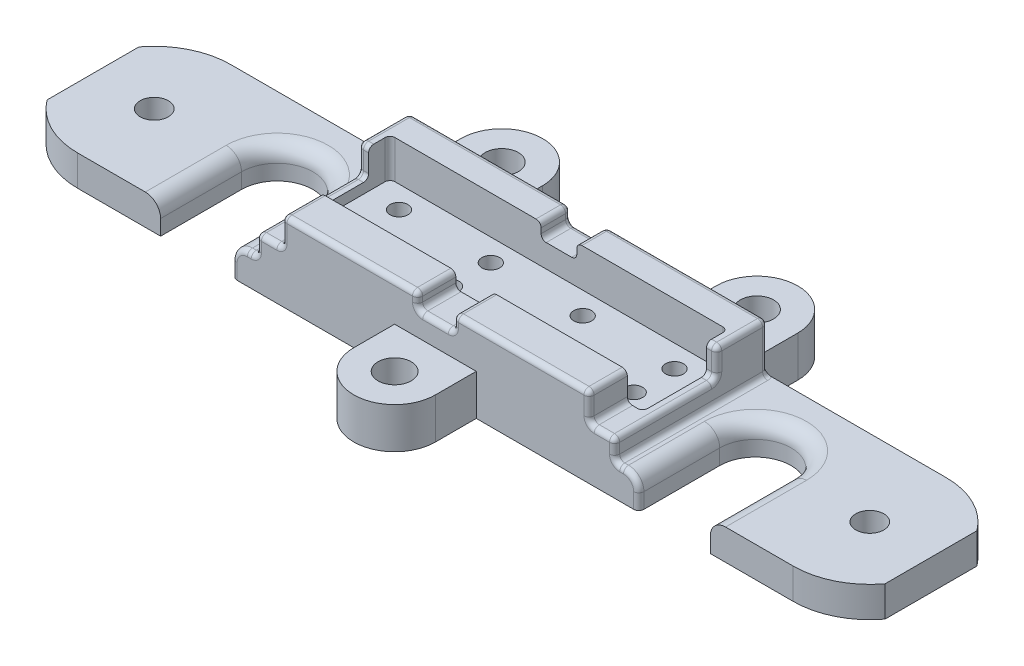
from build123d import *

# Parameters (mm, degrees)
SKETCH1_W               = 35.1
SKETCH1_H               = 30
BOSS_EXTRUDE1_DEPTH     = 15.5
SKETCH7_W               = 33.1
SKETCH7_H               = 16.7
CUT_EXTRUDE5_DEPTH      = 7.5
SKETCH2_R               = 1.75
CUT_EXTRUDE1_DEPTH      = 42.197815476
SKETCH4_W               = 20
SKETCH4_H               = 5.5
CUT_EXTRUDE3_DEPTH      = 5
SKETCH8_R               = 2.75
BOLT_EXTRUDE_DEPTH      = 6
FILLET3_R               = 1
SKETCH9_W               = 7
SKETCH9_H               = 30
CUT_EXTRUDE6_DEPTH      = 3
FILLET6_R               = 1
FILLET9_R               = 1
SKETCH11_W              = 140.2
SKETCH11_H              = 3
BOSS_EXTRUDE3_DEPTH     = 15
SKETCH12_R              = 3.25
BOSS_EXTRUDE4_DEPTH     = 8
CUT_EXTRUDE7_DEPTH      = 90.115991831
CUT_EXTRUDE7_DEPTH_BACK = 90.115991831
FILLET10_R              = 3
FILLET14_R              = 1
SKETCH13_W              = 62
SKETCH13_H              = 16
CUT_EXTRUDE8_DEPTH      = 4
FILLET15_R              = 2
FILLET16_R              = 0.5
SKETCH14_W              = 30
SKETCH14_H              = 15
CUT_EXTRUDE9_DEPTH      = 168.818026445


with BuildPart() as part:
    # Sketch1 → Boss-Extrude1 (new body)
    with BuildSketch(Plane(origin=(0, 0, 0), x_dir=(1, 0, 0), z_dir=(0, 1, 0))):
        with Locations((-17.55, 0)):
            Rectangle(SKETCH1_W, SKETCH1_H)
    extrude(amount=BOSS_EXTRUDE1_DEPTH)

    # Sketch7 → Cut-Extrude5 (cut)
    with BuildSketch(Plane(origin=(0, 15.5, 0), x_dir=(1, 0, 0), z_dir=(0, 1, 0))):
        with Locations((-16.55, 0.85)):
            Rectangle(SKETCH7_W, SKETCH7_H)
    extrude(amount=-CUT_EXTRUDE5_DEPTH, mode=Mode.SUBTRACT)

    # Sketch2 → Cut-Extrude1 (cut, through all)
    with BuildSketch(Plane(origin=(0, 0, 0), x_dir=(-1, 0, 0), z_dir=(0, 1, 0))):
        with Locations(Location((27, 3.15, 0), (0, 0, 270))):
            Circle(SKETCH2_R)
        with Locations(Location((9, 3.15, 0), (0, 0, 270))):
            Circle(SKETCH2_R)
        with Locations(Location((27, -4.85, 0), (0, 0, 270))):
            Circle(SKETCH2_R)
        with Locations(Location((9, -4.85, 0), (0, 0, 270))):
            Circle(SKETCH2_R)
    extrude(amount=CUT_EXTRUDE1_DEPTH, mode=Mode.SUBTRACT)

    # Sketch4 → Cut-Extrude3 (cut)
    with BuildSketch(Plane.ZY.offset(35.1)):
        with Locations((5, 12.75)):
            Rectangle(SKETCH4_W, SKETCH4_H)
    extrude(amount=-CUT_EXTRUDE3_DEPTH, mode=Mode.SUBTRACT)

    # Sketch8 → bolt extrude (add)
    with BuildSketch(Plane(origin=(0, 0, 0), x_dir=(-1, 0, 0), z_dir=(0, -1, 0))):
        with BuildLine():
            Line((35.1, -15), (70.1, -15))
            ThreePointArc((70.1, -15), (76.808203932, -13.416407865), (82.1, -9))
            Line((82.1, -9), (82.1, 9))
            ThreePointArc((82.1, 9), (76.808203932, 13.416407865), (70.1, 15))
            Line((70.1, 15), (35.1, 15))
            Line((35.1, 15), (35.1, -15))
        make_face()
        with Locations(Location((70.1, 0, 0), (0, 0, 90))):
            Circle(SKETCH8_R, mode=Mode.SUBTRACT)
    extrude(amount=-BOLT_EXTRUDE_DEPTH)

    # Mirror1: part across plane


with BuildPart() as part_1:
    add(part.part)
    add(part.part.mirror(Plane(origin=(0, 0, 0), x_dir=(0, 0, 1), z_dir=(1, 0, 0))))

    # Fillet3
    fillet3_edges = [part_1.edges().sort_by_distance(p)[0] for p in [
        (-34.1, 10, -5),
        (-34.1, 15.5, -5),
        (-30.1, 15.5, 11.25),
        (-30.1, 10, 11.25),
        (34.1, 15.5, -5),
        (34.1, 10, -5),
        (30.1, 15.5, 11.25),
        (30.1, 10, 11.25),
    ]]
    fillet(fillet3_edges, radius=FILLET3_R)

    # Sketch9 → Cut-Extrude6 (cut)
    with BuildSketch(Plane(origin=(0, 15.5, 0), x_dir=(1, 0, 0), z_dir=(0, 1, 0))):
        Rectangle(SKETCH9_W, SKETCH9_H)
    extrude(amount=-CUT_EXTRUDE6_DEPTH, mode=Mode.SUBTRACT)

    # Fillet6
    fillet6_edges = [part_1.edges().sort_by_distance(p)[0] for p in [
        (-33.1, 11.75, -9.2),
        (-33.1, 9, 7.5),
        (-3.5, 12.5, -12.1),
        (-3.5, 12.5, 11.25),
        (3.5, 12.5, -12.1),
        (3.5, 12.5, 11.25),
        (-3.5, 15.5, -12.1),
        (3.5, 15.5, -12.1),
        (3.5, 15.5, 11.25),
        (-3.5, 15.5, 11.25),
        (-35.1, 10.75, -15),
        (35.1, 10.75, -15),
        (33.1, 11.75, -9.2),
        (33.1, 9, 7.5),
    ]]
    fillet(fillet6_edges, radius=FILLET6_R)

    # Fillet9
    # the kernel refuses this fillet: 1 mm, written as the material it adds along each edge
    with BuildSketch(Plane(origin=(35.1, 6, -14), x_dir=(1, 0, 0), z_dir=(0, 0, 1)), Plane(origin=(-35.1, 6, -14), x_dir=(0, 1, 0), z_dir=(0, 0, 1))) as fillet9_piece_1:
        with BuildLine():
            CenterArc((FILLET9_R, FILLET9_R), FILLET9_R, 180, 90)
            Line((0, FILLET9_R), (0, 0))
            Line((0, 0), (FILLET9_R, 0))
        make_face()
    extrude(amount=29)
    with BuildSketch(Plane(origin=(34.1, 6, -14), x_dir=(1, 0, 0), z_dir=(0, 0, 1))) as fillet9_piece_2_section:
        with BuildLine():
            CenterArc((1 + FILLET9_R, FILLET9_R), FILLET9_R, 180, 90)
            Line((1 + FILLET9_R, 0), (1, 0))
            Line((1, 0), (1, FILLET9_R))
        make_face()
    fillet9_piece_2 = revolve(axis=Axis((34.1, 6, -14), (0, 1, 0)), revolution_arc=233.296989237, mode=Mode.PRIVATE)
    fillet9_piece_2 = split(fillet9_piece_2, bisect_by=Plane(origin=(34.849938881, 6.311628394, -15), z_dir=(0, 0, 1)), keep=Keep.TOP, mode=Mode.PRIVATE)
    add(fillet9_piece_2)
    with BuildSketch(Plane(origin=(-34.1, 6, -14), x_dir=(-1, 0, 0), z_dir=(0, 0, 1))) as fillet9_piece_3_section:
        with BuildLine():
            CenterArc((1 + FILLET9_R, -FILLET9_R), FILLET9_R, 90, 90)
            Line((1 + FILLET9_R, 0), (1, 0))
            Line((1, 0), (1, -FILLET9_R))
        make_face()
    fillet9_piece_3 = revolve(axis=Axis((-34.1, 6, -14), (0, -1, 0)), revolution_arc=233.296989237, mode=Mode.PRIVATE)
    fillet9_piece_3 = split(fillet9_piece_3, bisect_by=Plane(origin=(-34.849938995, 6.3116281, -15), z_dir=(0, 0, 1)), keep=Keep.TOP, mode=Mode.PRIVATE)
    add(fillet9_piece_3)
    # the kernel refuses this fillet: 1 mm, written as the material it takes off along each edge
    with BuildSketch(Plane(origin=(35.1, 10, 17.5), x_dir=(-1, 0, 0), z_dir=(0, 0, -1)), Plane(origin=(-35.1, 10, 17.5), x_dir=(0, -1, 0), z_dir=(0, 0, -1))) as fillet9_2_piece_1:
        with BuildLine():
            CenterArc((FILLET9_R, -FILLET9_R), FILLET9_R, 90, 90)
            Line((0, -FILLET9_R), (0, 0))
            Line((0, 0), (FILLET9_R, 0))
        make_face()
    extrude(amount=21.5, mode=Mode.SUBTRACT)
    with BuildSketch(Plane(origin=(35.1, 11, -5), x_dir=(0, 0, -1), z_dir=(0, 1, 0))) as fillet9_2_piece_2:
        with BuildLine():
            CenterArc((FILLET9_R, FILLET9_R), FILLET9_R, 180, 90)
            Line((0, FILLET9_R), (0, 0))
            Line((0, 0), (FILLET9_R, 0))
        make_face()
    extrude(amount=3.5, mode=Mode.SUBTRACT)
    with BuildSketch(Plane(origin=(35.1, 14.5, -6), x_dir=(0, 1, 0), z_dir=(0, 0, -1))) as fillet9_2_piece_3:
        with BuildLine():
            CenterArc((1 - FILLET9_R, -FILLET9_R), FILLET9_R, 0, 90)
            Line((1, -FILLET9_R), (1, 0))
            Line((1, 0), (1 - FILLET9_R, 0))
        make_face()
    revolve(axis=Axis((35.1, 14.5, -6), (1, 0, 0)), revolution_arc=90, mode=Mode.SUBTRACT)
    with BuildSketch(Plane(origin=(-35.1, 11, -5), x_dir=(0, 0, -1), z_dir=(0, 1, 0))) as fillet9_2_piece_4:
        with BuildLine():
            CenterArc((FILLET9_R, -FILLET9_R), FILLET9_R, 90, 90)
            Line((0, -FILLET9_R), (0, 0))
            Line((0, 0), (FILLET9_R, 0))
        make_face()
    extrude(amount=3.5, mode=Mode.SUBTRACT)
    with BuildSketch(Plane(origin=(-35.1, 14.5, -6), x_dir=(0, 1, 0), z_dir=(0, 0, -1))) as fillet9_2_piece_5:
        with BuildLine():
            CenterArc((1 - FILLET9_R, FILLET9_R), FILLET9_R, 270, 90)
            Line((1, FILLET9_R), (1, 0))
            Line((1, 0), (1 - FILLET9_R, 0))
        make_face()
    revolve(axis=Axis((-35.1, 14.5, -6), (1, 0, 0)), revolution_arc=90, mode=Mode.SUBTRACT)
    with BuildSketch(Plane(origin=(35.1, 11, -4), x_dir=(0, 0, -1), z_dir=(0, 1, 0))) as fillet9_2_piece_6:
        with BuildLine():
            CenterArc((1 + FILLET9_R, FILLET9_R), FILLET9_R, 180, 90)
            Line((1, FILLET9_R), (1, 0))
            Line((1, 0), (1 + FILLET9_R, 0))
        make_face()
    revolve(axis=Axis((35.1, 11, -4), (-1, 0, 0)), revolution_arc=90, mode=Mode.SUBTRACT)
    with BuildSketch(Plane(origin=(-35.1, 11, -4), x_dir=(0, 0, -1), z_dir=(0, 1, 0))) as fillet9_2_piece_7:
        with BuildLine():
            CenterArc((1 + FILLET9_R, -FILLET9_R), FILLET9_R, 90, 90)
            Line((1, -FILLET9_R), (1, 0))
            Line((1, 0), (1 + FILLET9_R, 0))
        make_face()
    revolve(axis=Axis((-35.1, 11, -4), (-1, 0, 0)), revolution_arc=90, mode=Mode.SUBTRACT)
    with BuildSketch(Plane(origin=(-3.5, 14.5, -15), x_dir=(-1, 0, 0), z_dir=(0, -1, 0))) as fillet9_2_piece_8:
        with BuildLine():
            CenterArc((FILLET9_R, -FILLET9_R), FILLET9_R, 90, 90)
            Line((0, -FILLET9_R), (0, 0))
            Line((0, 0), (FILLET9_R, 0))
        make_face()
    extrude(amount=1, mode=Mode.SUBTRACT)
    with BuildSketch(Plane(origin=(-34.1, 15.5, -15), x_dir=(0, -1, 0), z_dir=(1, 0, 0))) as fillet9_2_piece_9:
        with BuildLine():
            CenterArc((FILLET9_R, -FILLET9_R), FILLET9_R, 90, 90)
            Line((0, -FILLET9_R), (0, 0))
            Line((0, 0), (FILLET9_R, 0))
        make_face()
    extrude(amount=29.6, mode=Mode.SUBTRACT)
    with BuildSketch(Plane(origin=(-35.1, 15.5, -14), x_dir=(0, -1, 0), z_dir=(0, 0, 1))) as fillet9_2_piece_10:
        with BuildLine():
            CenterArc((FILLET9_R, FILLET9_R), FILLET9_R, 180, 90)
            Line((0, FILLET9_R), (0, 0))
            Line((0, 0), (FILLET9_R, 0))
        make_face()
    extrude(amount=8, mode=Mode.SUBTRACT)
    with BuildSketch(Plane(origin=(-34.1, 15.5, -14), x_dir=(-1, 0, 0), z_dir=(0, 0, 1))) as fillet9_2_piece_11:
        with BuildLine():
            CenterArc((1 - FILLET9_R, FILLET9_R), FILLET9_R, 270, 90)
            Line((1, FILLET9_R), (1, 0))
            Line((1, 0), (1 - FILLET9_R, 0))
        make_face()
    revolve(axis=Axis((-34.1, 15.5, -14), (0, -1, 0)), revolution_arc=90, mode=Mode.SUBTRACT)
    with BuildSketch(Plane(origin=(-2.5, 12.5, -15), x_dir=(0, -1, 0), z_dir=(1, 0, 0))) as fillet9_2_piece_12:
        with BuildLine():
            CenterArc((FILLET9_R, -FILLET9_R), FILLET9_R, 90, 90)
            Line((0, -FILLET9_R), (0, 0))
            Line((0, 0), (FILLET9_R, 0))
        make_face()
    extrude(amount=5, mode=Mode.SUBTRACT)
    with BuildSketch(Plane(origin=(3.5, 14.5, -15), x_dir=(1, 0, 0), z_dir=(0, -1, 0))) as fillet9_2_piece_13:
        with BuildLine():
            CenterArc((FILLET9_R, FILLET9_R), FILLET9_R, 180, 90)
            Line((0, FILLET9_R), (0, 0))
            Line((0, 0), (FILLET9_R, 0))
        make_face()
    extrude(amount=1, mode=Mode.SUBTRACT)
    with BuildSketch(Plane(origin=(4.5, 15.5, -15), x_dir=(0, 0, 1), z_dir=(1, 0, 0))) as fillet9_2_piece_14:
        with BuildLine():
            CenterArc((FILLET9_R, FILLET9_R), FILLET9_R, 180, 90)
            Line((0, FILLET9_R), (0, 0))
            Line((0, 0), (FILLET9_R, 0))
        make_face()
    extrude(amount=29.6, mode=Mode.SUBTRACT)
    with BuildSketch(Plane(origin=(4.5, 14.5, -15), x_dir=(0, 1, 0), z_dir=(1, 0, 0))) as fillet9_2_piece_15:
        with BuildLine():
            CenterArc((1 - FILLET9_R, FILLET9_R), FILLET9_R, 270, 90)
            Line((1, FILLET9_R), (1, 0))
            Line((1, 0), (1 - FILLET9_R, 0))
        make_face()
    revolve(axis=Axis((4.5, 14.5, -15), (0, 0, 1)), revolution_arc=90, mode=Mode.SUBTRACT)
    with BuildSketch(Plane(origin=(-4.5, 14.5, -15), x_dir=(0, 1, 0), z_dir=(-1, 0, 0))) as fillet9_2_piece_16:
        with BuildLine():
            CenterArc((1 - FILLET9_R, -FILLET9_R), FILLET9_R, 0, 90)
            Line((1, -FILLET9_R), (1, 0))
            Line((1, 0), (1 - FILLET9_R, 0))
        make_face()
    revolve(axis=Axis((-4.5, 14.5, -15), (0, 0, -1)), revolution_arc=90, mode=Mode.SUBTRACT)
    with BuildSketch(Plane(origin=(35.1, 15.5, -14), x_dir=(0, -1, 0), z_dir=(0, 0, 1))) as fillet9_2_piece_17:
        with BuildLine():
            CenterArc((FILLET9_R, -FILLET9_R), FILLET9_R, 90, 90)
            Line((0, -FILLET9_R), (0, 0))
            Line((0, 0), (FILLET9_R, 0))
        make_face()
    extrude(amount=8, mode=Mode.SUBTRACT)
    with BuildSketch(Plane(origin=(34.1, 15.5, -14), x_dir=(1, 0, 0), z_dir=(0, 0, 1))) as fillet9_2_piece_18:
        with BuildLine():
            CenterArc((1 - FILLET9_R, -FILLET9_R), FILLET9_R, 0, 90)
            Line((1, -FILLET9_R), (1, 0))
            Line((1, 0), (1 - FILLET9_R, 0))
        make_face()
    revolve(axis=Axis((34.1, 15.5, -14), (0, 1, 0)), revolution_arc=90, mode=Mode.SUBTRACT)
    with BuildSketch(Plane(origin=(-2.5, 13.5, -15), x_dir=(-1, 0, 0), z_dir=(0, 1, 0))) as fillet9_2_piece_19:
        with BuildLine():
            CenterArc((1 + FILLET9_R, FILLET9_R), FILLET9_R, 180, 90)
            Line((1, FILLET9_R), (1, 0))
            Line((1, 0), (1 + FILLET9_R, 0))
        make_face()
    revolve(axis=Axis((-2.5, 13.5, -15), (0, 0, 1)), revolution_arc=90, mode=Mode.SUBTRACT)
    with BuildSketch(Plane(origin=(2.5, 13.5, -15), x_dir=(0, -1, 0), z_dir=(-1, 0, 0))) as fillet9_2_piece_20:
        with BuildLine():
            CenterArc((1 + FILLET9_R, FILLET9_R), FILLET9_R, 180, 90)
            Line((1, FILLET9_R), (1, 0))
            Line((1, 0), (1 + FILLET9_R, 0))
        make_face()
    revolve(axis=Axis((2.5, 13.5, -15), (0, 0, 1)), revolution_arc=90, mode=Mode.SUBTRACT)

    # Sketch11 → Boss-Extrude3 (add)
    with BuildSketch(Plane.XZ):
        with Locations((0, -13.5)):
            Rectangle(SKETCH11_W, SKETCH11_H)
        with Locations((0, 13.5)):
            Rectangle(SKETCH11_W, SKETCH11_H)
    extrude(amount=BOSS_EXTRUDE3_DEPTH)

    # Sketch12 → Boss-Extrude4 (add)
    # profile 1 of 3: a face of its own
    with BuildSketch(Plane.XZ):
        with BuildLine():
            Line((-8, 15), (-8, 23))
            ThreePointArc((-8, 23), (0, 31), (8, 23))
            Line((8, 23), (8, 15))
            Line((8, 15), (-8, 15))
        make_face()
        with Locations(Location((0, 23, 0), (0, 0, 270))):
            Circle(SKETCH12_R, mode=Mode.SUBTRACT)
    # profile 2 of 3: a face of its own
    with BuildSketch(Plane.XZ):
        with BuildLine():
            Line((17, -15), (17, -23))
            ThreePointArc((17, -23), (25, -31), (33, -23))
            Line((33, -23), (33, -15))
            Line((33, -15), (17, -15))
        make_face()
        with Locations(Location((25, -23, 0), (0, 0, 270))):
            Circle(SKETCH12_R, mode=Mode.SUBTRACT)
    # profile 3 of 3: a face of its own
    with BuildSketch(Plane.XZ):
        with BuildLine():
            Line((-33, -15), (-33, -23))
            ThreePointArc((-33, -23), (-25, -31), (-17, -23))
            Line((-17, -23), (-17, -15))
            Line((-17, -15), (-33, -15))
        make_face()
        with Locations(Location((-25, -23, 0), (0, 0, 90))):
            Circle(SKETCH12_R, mode=Mode.SUBTRACT)
    extrude(amount=-BOSS_EXTRUDE4_DEPTH)

    # Sketch10 → Cut-Extrude7 (cut, two sides: drawn at the far end of the back side and taken through both)
    with BuildSketch(Plane(origin=(0, 0, 0), x_dir=(-1, 0, 0), z_dir=(0, -1, 0)).offset(-CUT_EXTRUDE7_DEPTH_BACK)):
        with BuildLine():
            Line((-39.85, 0.85), (-39.85, -15))
            Line((-39.85, -15), (-53.85, -15))
            Line((-53.85, -15), (-53.85, 0.85))
            ThreePointArc((-53.85, 0.85), (-46.85, 7.85), (-39.85, 0.85))
        make_face()
        with BuildLine():
            Line((39.85, 0.85), (39.85, -15))
            Line((39.85, -15), (53.85, -15))
            Line((53.85, -15), (53.85, 0.85))
            ThreePointArc((53.85, 0.85), (46.85, 7.85), (39.85, 0.85))
        make_face()
    extrude(amount=CUT_EXTRUDE7_DEPTH + CUT_EXTRUDE7_DEPTH_BACK, mode=Mode.SUBTRACT)

    # Fillet10
    fillet10_edges = [part_1.edges().sort_by_distance(p)[0] for p in [
        (46.85, 6, -7.85),
        (-46.85, 6, -7.85),
        (39.85, 6, 7.075),
        (53.85, 6, 7.075),
        (-53.85, 6, 7.075),
        (-39.85, 6, 7.075),
    ]]
    fillet(fillet10_edges, radius=FILLET10_R)

    # Fillet14
    fillet14_edges = [part_1.edges().sort_by_distance(p)[0] for p in [
        (30.1, 12.75, 15),
        (-30.1, 12.75, 15),
        (-32.6, 10, 15),
        (32.6, 10, 15),
        (-16.8, 15.5, 15),
        (-29.807106781, 15.207106781, 15),
        (29.807106781, 15.207106781, 15),
        (30.392893219, 10.292893219, 15),
        (-30.392893219, 10.292893219, 15),
        (3.5, 14, 15),
        (16.8, 15.5, 15),
        (0, 12.5, 15),
        (-3.5, 14, 15),
        (-3.792893219, 15.207106781, 15),
        (3.792893219, 15.207106781, 15),
        (3.207106781, 12.792893219, 15),
        (-3.207106781, 12.792893219, 15),
        (35.1, 8, 15),
        (-35.1, 8, 15),
        (-36.475, 6, 15),
        (36.475, 6, 15),
        (-34.807106781, 9.707106781, 15),
        (34.807106781, 9.707106781, 15),
        (35.392893219, 6.292893219, 15),
        (-35.392893219, 6.292893219, 15),
        (39.85, -6, 15),
        (-39.85, -6, 15),
        (-38.971320344, 5.121320344, 15),
        (38.971320344, 5.121320344, 15),
    ]]
    fillet(fillet14_edges, radius=FILLET14_R)

    # Sketch13 → Cut-Extrude8 (cut)
    with BuildSketch(Plane.XZ):
        with Locations((0, -0.85)):
            Rectangle(SKETCH13_W, SKETCH13_H)
    extrude(amount=-CUT_EXTRUDE8_DEPTH, mode=Mode.SUBTRACT)

    # Fillet15
    fillet15_edges = [part_1.edges().sort_by_distance(p)[0] for p in [
        (-31, 2, -8.85),
        (-31, 2, 7.15),
        (31, 2, 7.15),
        (31, 2, -8.85),
    ]]
    fillet(fillet15_edges, radius=FILLET15_R)

    # Fillet16
    fillet16_edges = [part_1.edges().sort_by_distance(p)[0] for p in [
        (31, 4, -0.85),
        (31, 0, -0.85),
        (0, 4, -8.85),
        (0, 0, -8.85),
        (-31, 4, -0.85),
        (0, 4, 7.15),
        (-30.414213562, 4, -8.264213562),
        (-30.414213562, 4, 6.564213562),
        (30.414213562, 4, 6.564213562),
        (30.414213562, 4, -8.264213562),
        (0, 0, 7.15),
        (-31, 0, -0.85),
        (30.414213562, 0, -8.264213562),
        (30.414213562, 0, 6.564213562),
        (-30.414213562, 0, 6.564213562),
        (-30.414213562, 0, -8.264213562),
    ]]
    fillet(fillet16_edges, radius=FILLET16_R)

    # Sketch14 → Cut-Extrude9 (cut, through all)
    with BuildSketch(Plane(origin=(82.1, 0, 0), x_dir=(0, 0, -1), z_dir=(1, 0, 0))):
        with Locations((0, -7.5)):
            Rectangle(SKETCH14_W, SKETCH14_H)
    extrude(amount=-CUT_EXTRUDE9_DEPTH, mode=Mode.SUBTRACT)


solid = part_1.part
